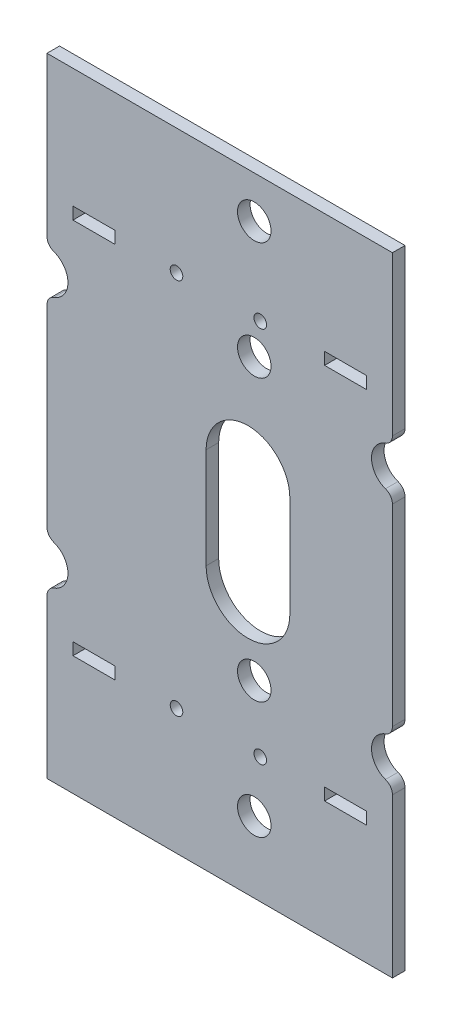
from build123d import *

# Parameters (mm, degrees)
SALIENTE_EXTRUIR1_START     = -1.5
SALIENTE_EXTRUIR1_OUTLINE_W = 10
SALIENTE_EXTRUIR1_OUTLINE_H = 2.9
SALIENTE_EXTRUIR1_OUTLINE_R = 1.5
SALIENTE_EXTRUIR1_DEPTH     = 3
CROQUIS2_R                  = 4
CORTAR_EXTRUIR1_DEPTH       = 10


# Read off the part's stored shape, not the designer's step: Saliente-Extruir1
with BuildPart() as part:
    # Saliente-Extruir1 outline → Saliente-Extruir1 (new body)
    with BuildSketch(Plane.XY.offset(SALIENTE_EXTRUIR1_START)):
        with BuildLine():
            ThreePointArc((492.916449572, 98.009593947), (492.452410006, 99.442022929), (491.249851225, 100.348134338))
            ThreePointArc((491.249851225, 100.348134338), (487.916517891, 105.062179546), (491.249851225, 109.776224754))
            ThreePointArc((491.249851225, 109.776224754), (492.452037009, 110.681812922), (492.916439741, 112.113480025))
            Line((492.916439741, 112.113480025), (492.916413331, 149.999679341))
            Line((492.916413331, 149.999679341), (410.416517891, 149.999679341))
            Line((410.416517891, 149.999679341), (410.416517891, 112.133247358))
            ThreePointArc((410.416517891, 112.133247358), (410.875276439, 110.689871685), (412.083184558, 109.776224754))
            ThreePointArc((412.083184558, 109.776224754), (415.416517891, 105.062179546), (412.083184558, 100.348134338))
            ThreePointArc((412.083184558, 100.348134338), (410.875276439, 99.434487407), (410.416517891, 97.991111734))
            Line((410.416517891, 97.991111734), (410.416517891, 52.008362374))
            ThreePointArc((410.416517891, 52.008362374), (410.875276439, 50.564986701), (412.083184558, 49.65133977))
            ThreePointArc((412.083184558, 49.65133977), (415.416517891, 44.937294562), (412.083184558, 40.223249354))
            ThreePointArc((412.083184558, 40.223249354), (410.875276439, 39.309602423), (410.416517891, 37.86622675))
            Line((410.416517891, 37.86622675), (410.416517891, -0.000320659))
            Line((410.416517891, -0.000320659), (492.916517891, -0.000320659))
            Line((492.916517891, -0.000320659), (492.916491488, 37.877716604))
            ThreePointArc((492.916491488, 37.877716604), (492.45443711, 39.314289338), (491.249851225, 40.223249354))
            ThreePointArc((491.249851225, 40.223249354), (487.916517891, 44.937294562), (491.249851225, 49.65133977))
            ThreePointArc((491.249851225, 49.65133977), (492.453865854, 50.559496169), (492.916481647, 51.994900607))
            Line((492.916481647, 51.994900607), (492.916449572, 98.009593947))
        make_face()
        with Locations((421.620579276, 29.951315893)):
            Rectangle(SALIENTE_EXTRUIR1_OUTLINE_W, SALIENTE_EXTRUIR1_OUTLINE_H, mode=Mode.SUBTRACT)
        with Locations((441.347923427, 29.951315893)):
            Circle(SALIENTE_EXTRUIR1_OUTLINE_R, mode=Mode.SUBTRACT)
        with Locations((461.347923427, 29.951315893)):
            Circle(SALIENTE_EXTRUIR1_OUTLINE_R, mode=Mode.SUBTRACT)
        with Locations((481.712351947, 29.951315893)):
            Rectangle(SALIENTE_EXTRUIR1_OUTLINE_W, SALIENTE_EXTRUIR1_OUTLINE_H, mode=Mode.SUBTRACT)
        with Locations((421.620579275, 120.047994692)):
            Rectangle(SALIENTE_EXTRUIR1_OUTLINE_W, SALIENTE_EXTRUIR1_OUTLINE_H, mode=Mode.SUBTRACT)
        with Locations((441.347923427, 120.047994692)):
            Circle(SALIENTE_EXTRUIR1_OUTLINE_R, mode=Mode.SUBTRACT)
        with BuildLine():
            ThreePointArc((448.416504048, 86.999703476), (458.416504048, 96.999703476), (468.416504048, 86.999703476))
            Line((468.416504048, 86.999703476), (468.416487259, 62.999703476))
            ThreePointArc((468.416487259, 62.999703476), (458.416483767, 52.999703476), (448.416487259, 62.999710459))
            Line((448.416487259, 62.999710459), (448.416504048, 86.999703476))
        make_face(mode=Mode.SUBTRACT)
        with Locations((461.347923427, 120.047994692)):
            Circle(SALIENTE_EXTRUIR1_OUTLINE_R, mode=Mode.SUBTRACT)
        with Locations((481.712351947, 120.047994692)):
            Rectangle(SALIENTE_EXTRUIR1_OUTLINE_W, SALIENTE_EXTRUIR1_OUTLINE_H, mode=Mode.SUBTRACT)
    extrude(amount=SALIENTE_EXTRUIR1_DEPTH)

    # Croquis2 → Cortar-Extruir1 (cut)
    with BuildSketch(Plane(origin=(0, 0, -1.5), x_dir=(-1, 0, 0), z_dir=(0, 0, -1))):
        with Locations((-459.916517891, 16.999737054)):
            Circle(CROQUIS2_R)
        with Locations((-459.916517891, 44.999737054)):
            Circle(CROQUIS2_R)
        with Locations((-459.916517891, 111.999737054)):
            Circle(CROQUIS2_R)
        with Locations((-459.916517891, 139.999737054)):
            Circle(CROQUIS2_R)
    extrude(amount=-CORTAR_EXTRUIR1_DEPTH, mode=Mode.SUBTRACT)


solid = part.part
